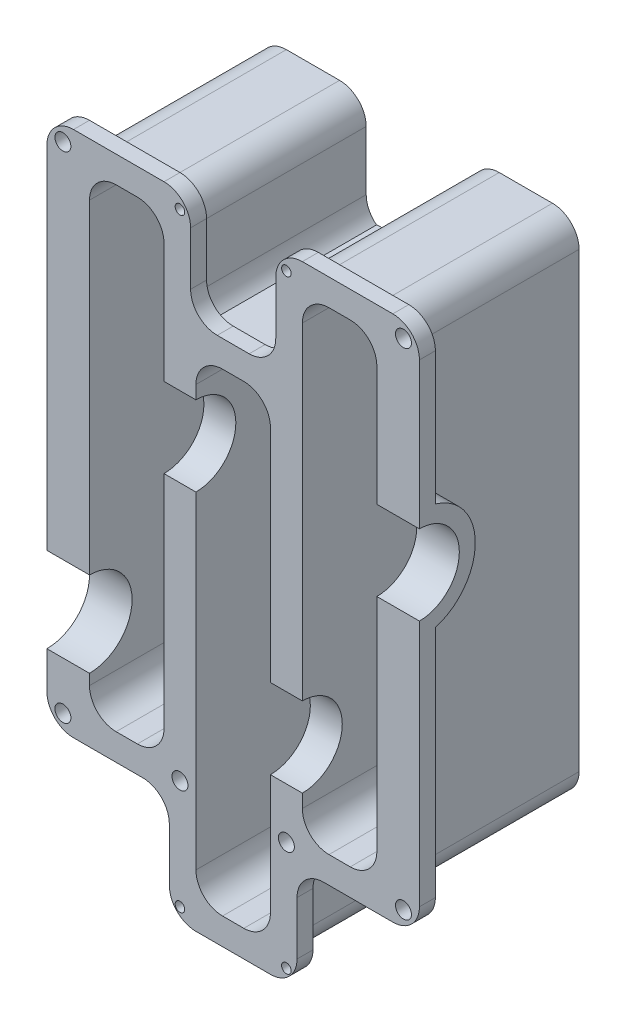
from build123d import *

# Parameters (mm, degrees)
SKETCH1_W           = 70
SKETCH1_H           = 119
BOSS_EXTRUDE1_DEPTH = 35
SKETCH2_R           = 8
CUT_EXTRUDE1_DEPTH  = 8
CUT_EXTRUDE2_DEPTH  = 32
SKETCH4_R           = 7.5
CUT_EXTRUDE3_DEPTH  = 8
SKETCH5_W           = 16
SKETCH5_H           = 20
SKETCH5_W_2         = 23
CUT_EXTRUDE4_DEPTH  = 78.396705356
CUT_EXTRUDE5_DEPTH  = 5
SKETCH7_W           = 18
SKETCH7_H           = 32
CUT_EXTRUDE6_DEPTH  = 2
SKETCH8_W           = 32
SKETCH8_H           = 22
CUT_EXTRUDE7_DEPTH  = 2
SKETCH9_W           = 22
SKETCH9_H           = 32
CUT_EXTRUDE8_DEPTH  = 2
SKETCH10_W          = 32
SKETCH10_H          = 18
CUT_EXTRUDE9_DEPTH  = 2
CUT_EXTRUDE11_DEPTH = 5
SKETCH13_W          = 20
SKETCH13_H          = 32
CUT_EXTRUDE12_DEPTH = 2
SKETCH14_W          = 22
SKETCH14_H          = 32
CUT_EXTRUDE13_DEPTH = 2
SKETCH15_W          = 32
SKETCH15_H          = 18
CUT_EXTRUDE14_DEPTH = 2
SKETCH16_W          = 18
SKETCH16_H          = 32
CUT_EXTRUDE15_DEPTH = 2
SKETCH17_W          = 32
SKETCH17_H          = 20.10525169
CUT_EXTRUDE16_DEPTH = 2
FILLET1_R           = 5
FILLET3_R           = 5
FILLET4_R           = 5
SKETCH18_R          = 1.5
CUT_EXTRUDE17_DEPTH = 10
SKETCH19_R          = 0.9
CUT_EXTRUDE18_DEPTH = 10
BOSS_EXTRUDE3_DEPTH = 6
BOSS_EXTRUDE4_START = -6
BOSS_EXTRUDE4_DEPTH = 6


with BuildPart() as part:
    # Sketch1 → Boss-Extrude1 (new body)
    with BuildSketch(Plane.XY):
        Rectangle(SKETCH1_W, SKETCH1_H)
    extrude(amount=BOSS_EXTRUDE1_DEPTH)

    # Sketch2 → Cut-Extrude1 (cut)
    with BuildSketch(Plane.ZY.offset(35)):
        with Locations((35, -19.5)):
            Circle(SKETCH2_R)
    extrude(amount=-CUT_EXTRUDE1_DEPTH, mode=Mode.SUBTRACT)

    # Sketch3 → Cut-Extrude2 (cut)
    with BuildSketch(Plane.XY.offset(35)):
        Polygon((-27, 54.5), (-13, 54.5), (-13, 27), (-7, 27), (-7, 34.5), (7, 34.5), (7, -12), (13, -12), (13, 54.5), (27, 54.5), (27, -34.5), (13, -34.5), (13, -27), (7, -27), (7, -54.5), (-7, -54.5), (-7, 12), (-13, 12), (-13, -34.5), (-27, -34.5), align=None)
    extrude(amount=-CUT_EXTRUDE2_DEPTH, mode=Mode.SUBTRACT)

    # Sketch4 → Cut-Extrude3 (cut)
    with BuildSketch(Plane(origin=(35, 0, 0), x_dir=(0, 0, -1), z_dir=(1, 0, 0))):
        with Locations((-35, 19.5)):
            Circle(SKETCH4_R)
    extrude(amount=-CUT_EXTRUDE3_DEPTH, mode=Mode.SUBTRACT)

    # Sketch5 → Cut-Extrude4 (cut, through all)
    with BuildSketch(Plane.XY.offset(35)):
        with Locations((0, 49.5)):
            Rectangle(SKETCH5_W, SKETCH5_H)
        with Locations((23.5, -49.5)):
            Rectangle(SKETCH5_W_2, SKETCH5_H)
        with Locations((-23.5, -49.5)):
            Rectangle(SKETCH5_W_2, SKETCH5_H)
    extrude(amount=-CUT_EXTRUDE4_DEPTH, mode=Mode.SUBTRACT)

    # Sketch6 → Cut-Extrude5 (cut)
    with BuildSketch(Plane(origin=(35, 0, 0), x_dir=(0, 0, -1), z_dir=(1, 0, 0))):
        with BuildLine():
            Line((-32, 59.5), (0, 59.5))
            Line((0, 59.5), (0, -39.5))
            Line((0, -39.5), (-32, -39.5))
            Line((-32, -39.5), (-32, 9.437694101))
            ThreePointArc((-32, 9.437694101), (-24.5, 19.5), (-32, 29.562305899))
            Line((-32, 29.562305899), (-32, 59.5))
        make_face()
    extrude(amount=-CUT_EXTRUDE5_DEPTH, mode=Mode.SUBTRACT)

    # Sketch7 → Cut-Extrude6 (cut)
    with BuildSketch(Plane.XZ.offset(39.5)):
        with Locations((21, 16)):
            Rectangle(SKETCH7_W, SKETCH7_H)
    extrude(amount=-CUT_EXTRUDE6_DEPTH, mode=Mode.SUBTRACT)

    # Sketch8 → Cut-Extrude7 (cut)
    with BuildSketch(Plane(origin=(12, 0, 0), x_dir=(0, 0, -1), z_dir=(1, 0, 0))):
        with Locations((-16, -48.5)):
            Rectangle(SKETCH8_W, SKETCH8_H)
    extrude(amount=-CUT_EXTRUDE7_DEPTH, mode=Mode.SUBTRACT)

    # Sketch9 → Cut-Extrude8 (cut)
    with BuildSketch(Plane.XZ.offset(59.5)):
        with Locations((-1, 16)):
            Rectangle(SKETCH9_W, SKETCH9_H)
    extrude(amount=-CUT_EXTRUDE8_DEPTH, mode=Mode.SUBTRACT)

    # Sketch10 → Cut-Extrude9 (cut)
    with BuildSketch(Plane.ZY.offset(12)):
        with Locations((16, -48.5)):
            Rectangle(SKETCH10_W, SKETCH10_H)
    extrude(amount=-CUT_EXTRUDE9_DEPTH, mode=Mode.SUBTRACT)

    # Sketch12 → Cut-Extrude11 (cut)
    with BuildSketch(Plane.ZY.offset(35)):
        with BuildLine():
            Line((32, 59.5), (0, 59.5))
            Line((0, 59.5), (0, -39.5))
            Line((0, -39.5), (32, -39.5))
            Line((32, -39.5), (32, -30.083005244))
            ThreePointArc((32, -30.083005244), (24, -19.5), (32, -8.916994756))
            Line((32, -8.916994756), (32, 59.5))
        make_face()
    extrude(amount=-CUT_EXTRUDE11_DEPTH, mode=Mode.SUBTRACT)

    # Sketch13 → Cut-Extrude12 (cut)
    with BuildSketch(Plane.XZ.offset(39.5)):
        with Locations((-20, 16)):
            Rectangle(SKETCH13_W, SKETCH13_H)
    extrude(amount=-CUT_EXTRUDE12_DEPTH, mode=Mode.SUBTRACT)

    # Sketch14 → Cut-Extrude13 (cut)
    with BuildSketch(Plane(origin=(0, 59.5, 0), x_dir=(1, 0, 0), z_dir=(0, 1, 0))):
        with Locations((19, -16)):
            Rectangle(SKETCH14_W, SKETCH14_H)
        with Locations((-19, -16)):
            Rectangle(SKETCH14_W, SKETCH14_H)
    extrude(amount=-CUT_EXTRUDE13_DEPTH, mode=Mode.SUBTRACT)

    # Sketch15 → Cut-Extrude14 (cut)
    with BuildSketch(Plane.ZY.offset(-8)):
        with Locations((16, 48.5)):
            Rectangle(SKETCH15_W, SKETCH15_H)
    extrude(amount=-CUT_EXTRUDE14_DEPTH, mode=Mode.SUBTRACT)

    # Sketch16 → Cut-Extrude15 (cut)
    with BuildSketch(Plane(origin=(0, 39.5, 0), x_dir=(1, 0, 0), z_dir=(0, 1, 0))):
        with Locations((1, -16)):
            Rectangle(SKETCH16_W, SKETCH16_H)
    extrude(amount=-CUT_EXTRUDE15_DEPTH, mode=Mode.SUBTRACT)

    # Sketch17 → Cut-Extrude16 (cut)
    with BuildSketch(Plane(origin=(-8, 0, 0), x_dir=(0, 0, -1), z_dir=(1, 0, 0))):
        with Locations((-16, 47.447374155)):
            Rectangle(SKETCH17_W, SKETCH17_H)
    extrude(amount=-CUT_EXTRUDE16_DEPTH, mode=Mode.SUBTRACT)

    # Fillet1
    fillet1_edges = [part.edges().sort_by_distance(p)[0] for p in [
        (-27, -34.5, 19),
        (-27, 54.5, 19),
        (-13, 54.5, 19),
        (-7, 34.5, 19),
        (7, 34.5, 19),
        (13, 54.5, 19),
        (27, 54.5, 19),
        (27, -34.5, 19),
        (13, -34.5, 19),
        (7, -54.5, 19),
        (-7, -54.5, 19),
        (-13, -34.5, 19),
    ]]
    fillet(fillet1_edges, radius=FILLET1_R)

    # Fillet3
    # the kernel refuses this fillet: 5 mm, written as the material it adds along each edge
    with BuildSketch(Plane(origin=(-10, -37.5, 0), x_dir=(0, -1, 0), z_dir=(0, 0, 1))) as fillet3_piece_1:
        with BuildLine():
            CenterArc((FILLET3_R, -FILLET3_R), FILLET3_R, 90, 90)
            Line((0, -FILLET3_R), (0, 0))
            Line((0, 0), (FILLET3_R, 0))
        make_face()
    extrude(amount=32)
    with BuildSketch(Plane(origin=(10, -37.5, 32), x_dir=(1, 0, 0), z_dir=(0, 0, -1)), Plane(origin=(10, 37.5, 0), x_dir=(0, 1, 0), z_dir=(0, 0, 1))) as fillet3_piece_2:
        with BuildLine():
            CenterArc((FILLET3_R, FILLET3_R), FILLET3_R, 180, 90)
            Line((0, FILLET3_R), (0, 0))
            Line((0, 0), (FILLET3_R, 0))
        make_face()
    extrude(amount=32)
    with BuildSketch(Plane(origin=(-10, 37.39474831, 32), x_dir=(1, 0, 0), z_dir=(0, 0, -1))) as fillet3_piece_3:
        with BuildLine():
            CenterArc((5, -4), FILLET3_R, 126.869897646, 53.130102354)
            Line((0, -4), (0, 0))
            Line((0, 0), (2, 0))
        make_face()
    extrude(amount=32)
    # the kernel refuses this fillet: 5 mm, written as the material it takes off along each edge
    with BuildSketch(Plane(origin=(-10, 57.5, -12.5), x_dir=(-1, 0, 0), z_dir=(0, 0, 1)), Plane(origin=(-30, -37.5, 32), x_dir=(0, 1, 0), z_dir=(0, 0, -1)), Plane(origin=(-10, -57.5, 32), x_dir=(0, 1, 0), z_dir=(0, 0, -1))) as fillet3_2_piece_1:
        with BuildLine():
            CenterArc((FILLET3_R, FILLET3_R), FILLET3_R, 180, 90)
            Line((0, FILLET3_R), (0, 0))
            Line((0, 0), (FILLET3_R, 0))
        make_face()
    extrude(amount=44.5, mode=Mode.SUBTRACT)
    with BuildSketch(Plane(origin=(-30, 57.5, 32), x_dir=(0, -1, 0), z_dir=(0, 0, -1)), Plane(origin=(30, -37.5, -12.5), x_dir=(-1, 0, 0), z_dir=(0, 0, 1)), Plane(origin=(30, 57.5, -12.5), x_dir=(0, -1, 0), z_dir=(0, 0, 1)), Plane(origin=(10, 57.5, 32), x_dir=(0, -1, 0), z_dir=(0, 0, -1)), Plane(origin=(10, -57.5, -12.5), x_dir=(-1, 0, 0), z_dir=(0, 0, 1))) as fillet3_2_piece_2:
        with BuildLine():
            CenterArc((FILLET3_R, -FILLET3_R), FILLET3_R, 90, 90)
            Line((0, -FILLET3_R), (0, 0))
            Line((0, 0), (FILLET3_R, 0))
        make_face()
    extrude(amount=44.5, mode=Mode.SUBTRACT)

    # Fillet4
    fillet4_edges = [part.edges().sort_by_distance(p)[0] for p in [
        (35, -39.5, 33.5),
        (12, -39.5, 33.5),
        (12, -59.5, 33.5),
        (-12, -59.5, 33.5),
        (-12, -39.5, 33.5),
        (-35, -39.5, 33.5),
        (8, 59.5, 33.5),
        (-8, 59.5, 33.5),
        (8, 39.5, 33.5),
        (-8, 39.5, 33.5),
        (-35, 59.5, 33.5),
        (35, 59.5, 33.5),
    ]]
    fillet(fillet4_edges, radius=FILLET4_R)

    # Sketch18 → Cut-Extrude17 (cut)
    with BuildSketch(Plane.XY.offset(35)):
        with Locations((-32, 56.5)):
            Circle(SKETCH18_R)
        with Locations((32, 56.5)):
            Circle(SKETCH18_R)
        with Locations((-32, -36.5)):
            Circle(SKETCH18_R)
        with Locations((-10, -36.5)):
            Circle(SKETCH18_R)
        with Locations((10, -36.5)):
            Circle(SKETCH18_R)
        with Locations((32, -36.5)):
            Circle(SKETCH18_R)
    extrude(amount=-CUT_EXTRUDE17_DEPTH, mode=Mode.SUBTRACT)

    # Sketch19 → Cut-Extrude18 (cut)
    with BuildSketch(Plane.XY.offset(35)):
        with Locations((-10, 56.5)):
            Circle(SKETCH19_R)
        with Locations((10, 56.5)):
            Circle(SKETCH19_R)
        with Locations((-10, -57)):
            Circle(SKETCH19_R)
        with Locations((10, -57)):
            Circle(SKETCH19_R)
    extrude(amount=-CUT_EXTRUDE18_DEPTH, mode=Mode.SUBTRACT)

    # Sketch20 → Boss-Extrude3 (add)
    with BuildSketch(Plane(origin=(13, 0, 0), x_dir=(0, 0, -1), z_dir=(1, 0, 0))):
        with BuildLine():
            Line((-35, -12), (-3, -12))
            Line((-3, -12), (-3, -27))
            Line((-3, -27), (-35, -27))
            ThreePointArc((-35, -27), (-27.5, -19.5), (-35, -12))
        make_face()
    extrude(amount=-BOSS_EXTRUDE3_DEPTH)

    # Sketch21 → Boss-Extrude4 (add)
    with BuildSketch(Plane.ZY.offset(13).offset(BOSS_EXTRUDE4_START)):
        with BuildLine():
            Line((35, 27), (3, 27))
            Line((3, 27), (3, 12))
            Line((3, 12), (35, 12))
            ThreePointArc((35, 12), (27.5, 19.5), (35, 27))
        make_face()
    extrude(amount=BOSS_EXTRUDE4_DEPTH)


solid = part.part
